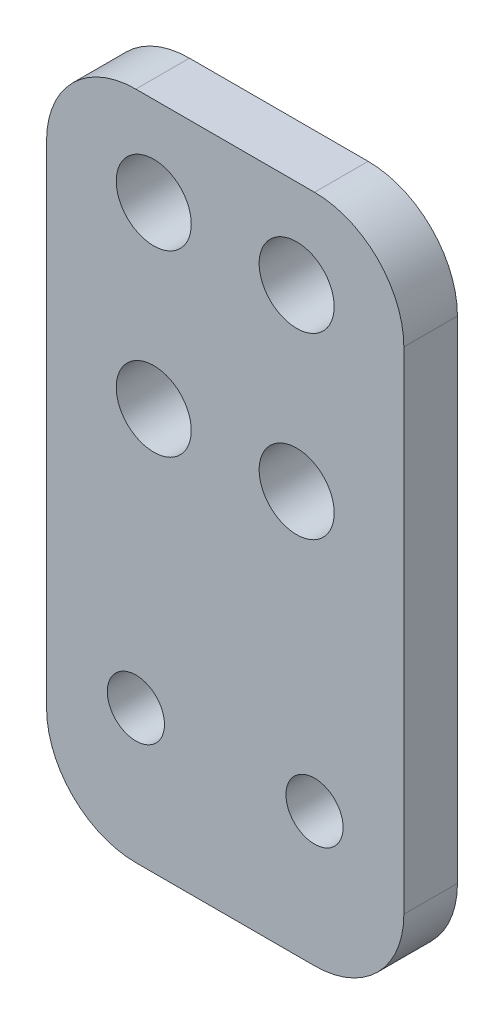
from build123d import *

# Parameters (mm, degrees)
SKETCH_2_W      = 20
SKETCH_2_H      = 37.5
SKETCH_2_R      = 2.1
SKETCH_2_R_2    = 1.6
EXTRUDE_1_DEPTH = 3
FILLET_1_R      = 5


with BuildPart() as part:
    # ｽｹｯﾁ2 → ﾎﾞｽ - 押し出し1 (new body)
    with BuildSketch(Plane.XY):
        with Locations((0, -8.75)):
            Rectangle(SKETCH_2_W, SKETCH_2_H)
        with Locations((-4, 5)):
            Circle(SKETCH_2_R, mode=Mode.SUBTRACT)
        with Locations((-4, -5)):
            Circle(SKETCH_2_R, mode=Mode.SUBTRACT)
        with Locations((4, -5)):
            Circle(SKETCH_2_R, mode=Mode.SUBTRACT)
        with Locations((4, 5)):
            Circle(SKETCH_2_R, mode=Mode.SUBTRACT)
        with Locations((5, -20)):
            Circle(SKETCH_2_R_2, mode=Mode.SUBTRACT)
        with Locations((-5, -20)):
            Circle(SKETCH_2_R_2, mode=Mode.SUBTRACT)
    extrude(amount=EXTRUDE_1_DEPTH)

    # ﾌｨﾚｯﾄ1
    fillet_1_edges = [part.edges().sort_by_distance(p)[0] for p in [
        (-10, -27.5, 1.5),
        (10, -27.5, 1.5),
        (-10, 10, 1.5),
        (10, 10, 1.5),
    ]]
    fillet(fillet_1_edges, radius=FILLET_1_R)


solid = part.part
